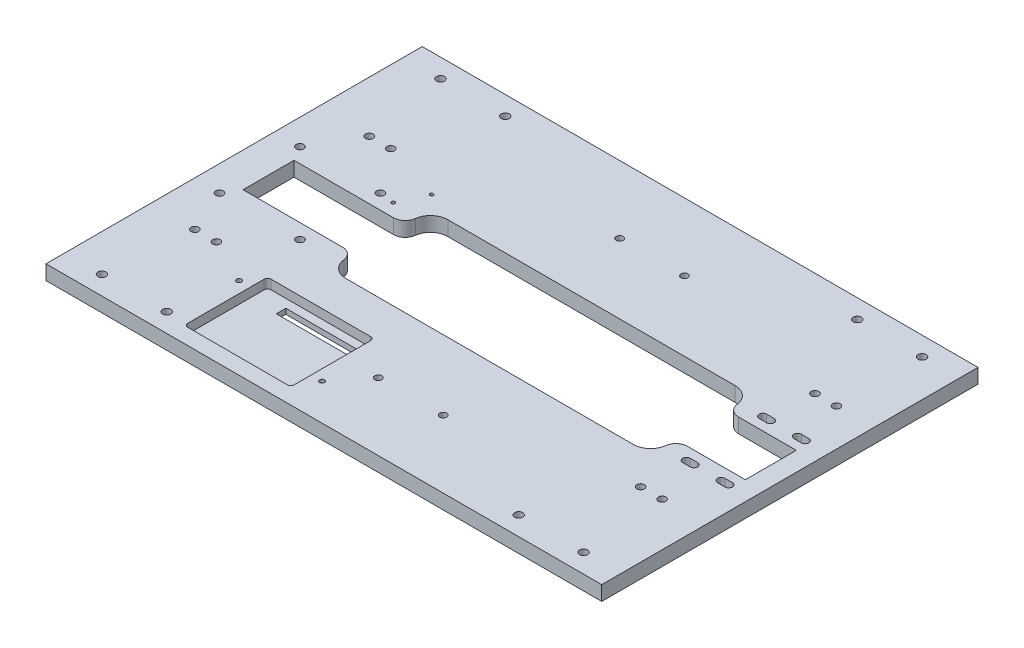
from build123d import *

# Parameters (mm, degrees)
SKETCH1_W           = 480
SKETCH1_H           = 325
BOSS_EXTRUDE1_DEPTH = 12.6
CUT_EXTRUDE1_REACH  = 292.112
SKETCH2_R           = 3
CUT_EXTRUDE2_REACH  = 292.112
FILLET1_R           = 10
CUT_EXTRUDE3_REACH  = 292.112
SKETCH4_R           = 3.3
FILLET2_R           = 10
CUT_EXTRUDE7_REACH  = 292.112
SKETCH7_R           = 2.25
SKETCH7_R_2         = 2.210159971
SKETCH7_R_3         = 2.104405515
SKETCH8_R           = 3.5
CUT_EXTRUDE8_DEPTH  = 6
CUT_EXTRUDE11_REACH = 292.112
SKETCH12_R          = 1.5
FILLET3_R           = 15
CUT_EXTRUDE12_DEPTH = 8
SKETCH14_W          = 63.584161833
SKETCH14_H          = 8.257095536
CUT_EXTRUDE13_DEPTH = 290.948702501
CUT_EXTRUDE14_REACH = 292.112
SKETCH15_R          = 3.25
CUT_EXTRUDE15_REACH = 292.112


with BuildPart() as part:
    # Sketch1 → Boss-Extrude1 (new body)
    with BuildSketch(Plane(origin=(0, 0, 0), x_dir=(1, 0, 0), z_dir=(0, 1, 0))):
        Rectangle(SKETCH1_W, SKETCH1_H)
    extrude(amount=BOSS_EXTRUDE1_DEPTH)

    # Sketch2 → Cut-Extrude1 (cut, up to next)
    with BuildSketch(Plane.XZ, mode=Mode.PRIVATE) as cut_extrude1_sk1:
        with Locations((44.748582867, -104.2)):
            Circle(SKETCH2_R)
    cut_extrude1_tool1 = extrude(cut_extrude1_sk1.sketch, amount=-CUT_EXTRUDE1_REACH, mode=Mode.PRIVATE) & part.part
    # Sketch2 → Cut-Extrude1 (cut, up to next)
    with BuildSketch(Plane.XZ, mode=Mode.PRIVATE) as cut_extrude1_sk2:
        with Locations((-11.251417133, -104.2)):
            Circle(SKETCH2_R)
    cut_extrude1_tool2 = extrude(cut_extrude1_sk2.sketch, amount=-CUT_EXTRUDE1_REACH, mode=Mode.PRIVATE) & part.part
    # Sketch2 → Cut-Extrude1 (cut, up to next)
    with BuildSketch(Plane.XZ, mode=Mode.PRIVATE) as cut_extrude1_sk3:
        with Locations((44.748582867, 104.2)):
            Circle(SKETCH2_R)
    cut_extrude1_tool3 = extrude(cut_extrude1_sk3.sketch, amount=-CUT_EXTRUDE1_REACH, mode=Mode.PRIVATE) & part.part
    # Sketch2 → Cut-Extrude1 (cut, up to next)
    with BuildSketch(Plane.XZ, mode=Mode.PRIVATE) as cut_extrude1_sk4:
        with Locations((-11.251417133, 104.2)):
            Circle(SKETCH2_R)
    cut_extrude1_tool4 = extrude(cut_extrude1_sk4.sketch, amount=-CUT_EXTRUDE1_REACH, mode=Mode.PRIVATE) & part.part
    add(cut_extrude1_tool1.solids().sort_by_distance((44.748583, 0, -104.2))[0], mode=Mode.SUBTRACT)
    add(cut_extrude1_tool2.solids().sort_by_distance((-11.251417, 0, -104.2))[0], mode=Mode.SUBTRACT)
    add(cut_extrude1_tool3.solids().sort_by_distance((44.748583, 0, 104.2))[0], mode=Mode.SUBTRACT)
    add(cut_extrude1_tool4.solids().sort_by_distance((-11.251417, 0, 104.2))[0], mode=Mode.SUBTRACT)

    # Sketch3 → Cut-Extrude2 (cut, up to next)
    with BuildSketch(Plane.XZ, mode=Mode.PRIVATE) as cut_extrude2_sk1:
        Polygon((163.584746975, 44), (-114.288669968, 44), (-114.288669968, 22), (-210.288669968, 22), (-210.288669968, -22), (-114.288669968, -22), (-114.288669968, -44), (163.584746975, -44), (163.584746975, -22), (223.584746975, -22), (223.584746975, 22), (163.584746975, 22), align=None)
    cut_extrude2_tool1 = extrude(cut_extrude2_sk1.sketch, amount=-CUT_EXTRUDE2_REACH, mode=Mode.PRIVATE) & part.part
    add(cut_extrude2_tool1.solids().sort_by_distance((13.675427, 0, 0))[0], mode=Mode.SUBTRACT)

    # Fillet1
    fillet1_edges = [part.edges().sort_by_distance(p)[0] for p in [
        (-114.288669968, 6.3, 22),
        (-114.288669968, 6.3, -22),
    ]]
    fillet(fillet1_edges, radius=FILLET1_R)

    # Sketch4 → Cut-Extrude3 (cut, up to next)
    with BuildSketch(Plane.XZ, mode=Mode.PRIVATE) as cut_extrude3_sk1:
        with Locations((-148.425714853, -34.75)):
            Circle(SKETCH4_R)
    cut_extrude3_tool1 = extrude(cut_extrude3_sk1.sketch, amount=-CUT_EXTRUDE3_REACH, mode=Mode.PRIVATE) & part.part
    # Sketch4 → Cut-Extrude3 (cut, up to next)
    with BuildSketch(Plane.XZ, mode=Mode.PRIVATE) as cut_extrude3_sk2:
        with Locations((-148.425714853, 34.75)):
            Circle(SKETCH4_R)
    cut_extrude3_tool2 = extrude(cut_extrude3_sk2.sketch, amount=-CUT_EXTRUDE3_REACH, mode=Mode.PRIVATE) & part.part
    # Sketch4 → Cut-Extrude3 (cut, up to next)
    with BuildSketch(Plane.XZ, mode=Mode.PRIVATE) as cut_extrude3_sk3:
        with Locations((-217.925714853, 34.75)):
            Circle(SKETCH4_R)
    cut_extrude3_tool3 = extrude(cut_extrude3_sk3.sketch, amount=-CUT_EXTRUDE3_REACH, mode=Mode.PRIVATE) & part.part
    # Sketch4 → Cut-Extrude3 (cut, up to next)
    with BuildSketch(Plane.XZ, mode=Mode.PRIVATE) as cut_extrude3_sk4:
        with Locations((-217.925714853, -34.75)):
            Circle(SKETCH4_R)
    cut_extrude3_tool4 = extrude(cut_extrude3_sk4.sketch, amount=-CUT_EXTRUDE3_REACH, mode=Mode.PRIVATE) & part.part
    add(cut_extrude3_tool1.solids().sort_by_distance((-148.425715, 0, -34.75))[0], mode=Mode.SUBTRACT)
    add(cut_extrude3_tool2.solids().sort_by_distance((-148.425715, 0, 34.75))[0], mode=Mode.SUBTRACT)
    add(cut_extrude3_tool3.solids().sort_by_distance((-217.925715, 0, 34.75))[0], mode=Mode.SUBTRACT)
    add(cut_extrude3_tool4.solids().sort_by_distance((-217.925715, 0, -34.75))[0], mode=Mode.SUBTRACT)

    # Fillet2
    fillet2_edges = [part.edges().sort_by_distance(p)[0] for p in [
        (163.584746975, 6.3, -22),
        (163.584746975, 6.3, 22),
    ]]
    fillet(fillet2_edges, radius=FILLET2_R)

    # Sketch7 → Cut-Extrude7 (cut, up to next)
    with BuildSketch(Plane(origin=(0, 12.6, 0), x_dir=(1, 0, 0), z_dir=(0, 1, 0)), mode=Mode.PRIVATE) as cut_extrude7_sk1:
        with Locations((208, -146.2)):
            Circle(SKETCH7_R)
    cut_extrude7_tool1 = extrude(cut_extrude7_sk1.sketch, amount=-CUT_EXTRUDE7_REACH, mode=Mode.PRIVATE) & part.part
    # Sketch7 → Cut-Extrude7 (cut, up to next)
    with BuildSketch(Plane(origin=(0, 12.6, 0), x_dir=(1, 0, 0), z_dir=(0, 1, 0)), mode=Mode.PRIVATE) as cut_extrude7_sk2:
        with Locations((152, -146.2)):
            Circle(SKETCH7_R)
    cut_extrude7_tool2 = extrude(cut_extrude7_sk2.sketch, amount=-CUT_EXTRUDE7_REACH, mode=Mode.PRIVATE) & part.part
    # Sketch7 → Cut-Extrude7 (cut, up to next)
    with BuildSketch(Plane(origin=(0, 12.6, 0), x_dir=(1, 0, 0), z_dir=(0, 1, 0)), mode=Mode.PRIVATE) as cut_extrude7_sk3:
        with Locations((-152, -146.2)):
            Circle(SKETCH7_R)
    cut_extrude7_tool3 = extrude(cut_extrude7_sk3.sketch, amount=-CUT_EXTRUDE7_REACH, mode=Mode.PRIVATE) & part.part
    # Sketch7 → Cut-Extrude7 (cut, up to next)
    with BuildSketch(Plane(origin=(0, 12.6, 0), x_dir=(1, 0, 0), z_dir=(0, 1, 0)), mode=Mode.PRIVATE) as cut_extrude7_sk4:
        with Locations((-208, -146.2)):
            Circle(SKETCH7_R)
    cut_extrude7_tool4 = extrude(cut_extrude7_sk4.sketch, amount=-CUT_EXTRUDE7_REACH, mode=Mode.PRIVATE) & part.part
    # Sketch7 → Cut-Extrude7 (cut, up to next)
    with BuildSketch(Plane(origin=(0, 12.6, 0), x_dir=(1, 0, 0), z_dir=(0, 1, 0)), mode=Mode.PRIVATE) as cut_extrude7_sk5:
        with Locations((-208, 146.2)):
            Circle(SKETCH7_R)
    cut_extrude7_tool5 = extrude(cut_extrude7_sk5.sketch, amount=-CUT_EXTRUDE7_REACH, mode=Mode.PRIVATE) & part.part
    # Sketch7 → Cut-Extrude7 (cut, up to next)
    with BuildSketch(Plane(origin=(0, 12.6, 0), x_dir=(1, 0, 0), z_dir=(0, 1, 0)), mode=Mode.PRIVATE) as cut_extrude7_sk6:
        with Locations((-152, 146.2)):
            Circle(SKETCH7_R)
    cut_extrude7_tool6 = extrude(cut_extrude7_sk6.sketch, amount=-CUT_EXTRUDE7_REACH, mode=Mode.PRIVATE) & part.part
    # Sketch7 → Cut-Extrude7 (cut, up to next)
    with BuildSketch(Plane(origin=(0, 12.6, 0), x_dir=(1, 0, 0), z_dir=(0, 1, 0)), mode=Mode.PRIVATE) as cut_extrude7_sk7:
        with Locations((208, 146.2)):
            Circle(SKETCH7_R)
    cut_extrude7_tool7 = extrude(cut_extrude7_sk7.sketch, amount=-CUT_EXTRUDE7_REACH, mode=Mode.PRIVATE) & part.part
    # Sketch7 → Cut-Extrude7 (cut, up to next)
    with BuildSketch(Plane(origin=(0, 12.6, 0), x_dir=(1, 0, 0), z_dir=(0, 1, 0)), mode=Mode.PRIVATE) as cut_extrude7_sk8:
        with Locations((152, 146.2)):
            Circle(SKETCH7_R)
    cut_extrude7_tool8 = extrude(cut_extrude7_sk8.sketch, amount=-CUT_EXTRUDE7_REACH, mode=Mode.PRIVATE) & part.part
    # Sketch7 → Cut-Extrude7 (cut, up to next)
    with BuildSketch(Plane(origin=(0, 12.6, 0), x_dir=(1, 0, 0), z_dir=(0, 1, 0)), mode=Mode.PRIVATE) as cut_extrude7_sk9:
        with Locations((-143.975181306, -91.729163581)):
            Circle(SKETCH7_R_2)
    cut_extrude7_tool9 = extrude(cut_extrude7_sk9.sketch, amount=-CUT_EXTRUDE7_REACH, mode=Mode.PRIVATE) & part.part
    # Sketch7 → Cut-Extrude7 (cut, up to next)
    with BuildSketch(Plane(origin=(0, 12.6, 0), x_dir=(1, 0, 0), z_dir=(0, 1, 0)), mode=Mode.PRIVATE) as cut_extrude7_sk10:
        with Locations((-32.975181306, -131.130382474)):
            Circle(SKETCH7_R_3)
    cut_extrude7_tool10 = extrude(cut_extrude7_sk10.sketch, amount=-CUT_EXTRUDE7_REACH, mode=Mode.PRIVATE) & part.part
    add(cut_extrude7_tool1.solids().sort_by_distance((208, 12.6, 146.2))[0], mode=Mode.SUBTRACT)
    add(cut_extrude7_tool2.solids().sort_by_distance((152, 12.6, 146.2))[0], mode=Mode.SUBTRACT)
    add(cut_extrude7_tool3.solids().sort_by_distance((-152, 12.6, 146.2))[0], mode=Mode.SUBTRACT)
    add(cut_extrude7_tool4.solids().sort_by_distance((-208, 12.6, 146.2))[0], mode=Mode.SUBTRACT)
    add(cut_extrude7_tool5.solids().sort_by_distance((-208, 12.6, -146.2))[0], mode=Mode.SUBTRACT)
    add(cut_extrude7_tool6.solids().sort_by_distance((-152, 12.6, -146.2))[0], mode=Mode.SUBTRACT)
    add(cut_extrude7_tool7.solids().sort_by_distance((208, 12.6, -146.2))[0], mode=Mode.SUBTRACT)
    add(cut_extrude7_tool8.solids().sort_by_distance((152, 12.6, -146.2))[0], mode=Mode.SUBTRACT)
    add(cut_extrude7_tool9.solids().sort_by_distance((-143.975181, 12.6, 91.729164))[0], mode=Mode.SUBTRACT)
    add(cut_extrude7_tool10.solids().sort_by_distance((-32.975181, 12.6, 131.130382))[0], mode=Mode.SUBTRACT)

    # Sketch8 → Cut-Extrude8 (cut)
    with BuildSketch(Plane(origin=(0, 12.6, 0), x_dir=(1, 0, 0), z_dir=(0, 1, 0))):
        with Locations((208, 146.2)):
            Circle(SKETCH8_R)
        with Locations((152, 146.2)):
            Circle(SKETCH8_R)
        with Locations((-152, 146.2)):
            Circle(SKETCH8_R)
        with Locations((-208, 146.2)):
            Circle(SKETCH8_R)
        with Locations((208, -146.2)):
            Circle(SKETCH8_R)
        with Locations((152, -146.2)):
            Circle(SKETCH8_R)
        with Locations((-208, -146.2)):
            Circle(SKETCH8_R)
        with Locations((-152, -146.2)):
            Circle(SKETCH8_R)
    extrude(amount=-CUT_EXTRUDE8_DEPTH, mode=Mode.SUBTRACT)

    # Sketch12 → Cut-Extrude11 (cut, up to next)
    with BuildSketch(Plane.XZ, mode=Mode.PRIVATE) as cut_extrude11_sk1:
        with Locations((-135.814791711, -33.263055365)):
            Circle(SKETCH12_R)
    cut_extrude11_tool1 = extrude(cut_extrude11_sk1.sketch, amount=-CUT_EXTRUDE11_REACH, mode=Mode.PRIVATE) & part.part
    # Sketch12 → Cut-Extrude11 (cut, up to next)
    with BuildSketch(Plane.XZ, mode=Mode.PRIVATE) as cut_extrude11_sk2:
        with Locations((-125.214791711, -55.863055365)):
            Circle(SKETCH12_R)
    cut_extrude11_tool2 = extrude(cut_extrude11_sk2.sketch, amount=-CUT_EXTRUDE11_REACH, mode=Mode.PRIVATE) & part.part
    add(cut_extrude11_tool1.solids().sort_by_distance((-135.814792, 0, -33.263055))[0], mode=Mode.SUBTRACT)
    add(cut_extrude11_tool2.solids().sort_by_distance((-125.214792, 0, -55.863055))[0], mode=Mode.SUBTRACT)

    # Fillet3
    fillet3_edges = [part.edges().sort_by_distance(p)[0] for p in [
        (163.584746975, 6.3, 44),
        (163.584746975, 6.3, -44),
        (-114.288669968, 6.3, 44),
        (-114.288669968, 6.3, -44),
    ]]
    fillet(fillet3_edges, radius=FILLET3_R)

    # Sketch9 → Cut-Extrude12 (cut)
    with BuildSketch(Plane(origin=(0, 12.6, 0), x_dir=(1, 0, 0), z_dir=(0, 1, 0))):
        with BuildLine():
            Line((-131.275181306, -76.793200215), (-45.275181306, -76.793200215))
            ThreePointArc((-45.275181306, -76.793200215), (-43.153860962, -77.671879872), (-42.275181306, -79.793200215))
            Line((-42.275181306, -79.793200215), (-42.275181306, -145.793200215))
            ThreePointArc((-42.275181306, -145.793200215), (-43.153860962, -147.914520559), (-45.275181306, -148.793200215))
            Line((-45.275181306, -148.793200215), (-131.275181306, -148.793200215))
            ThreePointArc((-131.275181306, -148.793200215), (-133.396501649, -147.914520559), (-134.275181306, -145.793200215))
            Line((-134.275181306, -145.793200215), (-134.275181306, -79.793200215))
            ThreePointArc((-134.275181306, -79.793200215), (-133.396501649, -77.671879872), (-131.275181306, -76.793200215))
        make_face()
    extrude(amount=-CUT_EXTRUDE12_DEPTH, mode=Mode.SUBTRACT)

    # Sketch14 → Cut-Extrude13 (cut, through all)
    with BuildSketch(Plane(origin=(0, 4.6, 0), x_dir=(1, 0, 0), z_dir=(0, 1, 0))):
        with Locations((-79.365102285, -88.291865052)):
            Rectangle(SKETCH14_W, SKETCH14_H)
    extrude(amount=-CUT_EXTRUDE13_DEPTH, mode=Mode.SUBTRACT)

    # Sketch15 → Cut-Extrude14 (cut, up to next)
    with BuildSketch(Plane(origin=(0, 12.6, 0), x_dir=(1, 0, 0), z_dir=(0, 1, 0)), mode=Mode.PRIVATE) as cut_extrude14_sk1:
        with Locations((-201.37519906, -72.5)):
            Circle(SKETCH15_R)
    cut_extrude14_tool1 = extrude(cut_extrude14_sk1.sketch, amount=-CUT_EXTRUDE14_REACH, mode=Mode.PRIVATE) & part.part
    # Sketch15 → Cut-Extrude14 (cut, up to next)
    with BuildSketch(Plane(origin=(0, 12.6, 0), x_dir=(1, 0, 0), z_dir=(0, 1, 0)), mode=Mode.PRIVATE) as cut_extrude14_sk2:
        with Locations((-182.864719491, -72.5)):
            Circle(SKETCH15_R)
    cut_extrude14_tool2 = extrude(cut_extrude14_sk2.sketch, amount=-CUT_EXTRUDE14_REACH, mode=Mode.PRIVATE) & part.part
    # Sketch15 → Cut-Extrude14 (cut, up to next)
    with BuildSketch(Plane(origin=(0, 12.6, 0), x_dir=(1, 0, 0), z_dir=(0, 1, 0)), mode=Mode.PRIVATE) as cut_extrude14_sk3:
        with Locations((-195.791828434, 72.5)):
            Circle(SKETCH15_R)
    cut_extrude14_tool3 = extrude(cut_extrude14_sk3.sketch, amount=-CUT_EXTRUDE14_REACH, mode=Mode.PRIVATE) & part.part
    # Sketch15 → Cut-Extrude14 (cut, up to next)
    with BuildSketch(Plane(origin=(0, 12.6, 0), x_dir=(1, 0, 0), z_dir=(0, 1, 0)), mode=Mode.PRIVATE) as cut_extrude14_sk4:
        with Locations((-177.281348865, 72.5)):
            Circle(SKETCH15_R)
    cut_extrude14_tool4 = extrude(cut_extrude14_sk4.sketch, amount=-CUT_EXTRUDE14_REACH, mode=Mode.PRIVATE) & part.part
    # Sketch15 → Cut-Extrude14 (cut, up to next)
    with BuildSketch(Plane(origin=(0, 12.6, 0), x_dir=(1, 0, 0), z_dir=(0, 1, 0)), mode=Mode.PRIVATE) as cut_extrude14_sk5:
        with Locations((189.208171566, 72.5)):
            Circle(SKETCH15_R)
    cut_extrude14_tool5 = extrude(cut_extrude14_sk5.sketch, amount=-CUT_EXTRUDE14_REACH, mode=Mode.PRIVATE) & part.part
    # Sketch15 → Cut-Extrude14 (cut, up to next)
    with BuildSketch(Plane(origin=(0, 12.6, 0), x_dir=(1, 0, 0), z_dir=(0, 1, 0)), mode=Mode.PRIVATE) as cut_extrude14_sk6:
        with Locations((207.718651135, 72.5)):
            Circle(SKETCH15_R)
    cut_extrude14_tool6 = extrude(cut_extrude14_sk6.sketch, amount=-CUT_EXTRUDE14_REACH, mode=Mode.PRIVATE) & part.part
    # Sketch15 → Cut-Extrude14 (cut, up to next)
    with BuildSketch(Plane(origin=(0, 12.6, 0), x_dir=(1, 0, 0), z_dir=(0, 1, 0)), mode=Mode.PRIVATE) as cut_extrude14_sk7:
        with Locations((183.62480094, -72.5)):
            Circle(SKETCH15_R)
    cut_extrude14_tool7 = extrude(cut_extrude14_sk7.sketch, amount=-CUT_EXTRUDE14_REACH, mode=Mode.PRIVATE) & part.part
    # Sketch15 → Cut-Extrude14 (cut, up to next)
    with BuildSketch(Plane(origin=(0, 12.6, 0), x_dir=(1, 0, 0), z_dir=(0, 1, 0)), mode=Mode.PRIVATE) as cut_extrude14_sk8:
        with Locations((202.135280509, -72.5)):
            Circle(SKETCH15_R)
    cut_extrude14_tool8 = extrude(cut_extrude14_sk8.sketch, amount=-CUT_EXTRUDE14_REACH, mode=Mode.PRIVATE) & part.part
    add(cut_extrude14_tool1.solids().sort_by_distance((-201.375199, 12.6, 72.5))[0], mode=Mode.SUBTRACT)
    add(cut_extrude14_tool2.solids().sort_by_distance((-182.864719, 12.6, 72.5))[0], mode=Mode.SUBTRACT)
    add(cut_extrude14_tool3.solids().sort_by_distance((-195.791828, 12.6, -72.5))[0], mode=Mode.SUBTRACT)
    add(cut_extrude14_tool4.solids().sort_by_distance((-177.281349, 12.6, -72.5))[0], mode=Mode.SUBTRACT)
    add(cut_extrude14_tool5.solids().sort_by_distance((189.208172, 12.6, -72.5))[0], mode=Mode.SUBTRACT)
    add(cut_extrude14_tool6.solids().sort_by_distance((207.718651, 12.6, -72.5))[0], mode=Mode.SUBTRACT)
    add(cut_extrude14_tool7.solids().sort_by_distance((183.624801, 12.6, 72.5))[0], mode=Mode.SUBTRACT)
    add(cut_extrude14_tool8.solids().sort_by_distance((202.135281, 12.6, 72.5))[0], mode=Mode.SUBTRACT)

    # Sketch16 → Cut-Extrude15 (cut, up to next)
    with BuildSketch(Plane(origin=(0, 12.6, 0), x_dir=(1, 0, 0), z_dir=(0, 1, 0)), mode=Mode.PRIVATE) as cut_extrude15_sk1:
        with BuildLine():
            Line((183.672880587, -36.25), (190.172880587, -36.25))
            ThreePointArc((190.172880587, -36.25), (193.422880587, -33), (190.172880587, -29.75))
            Line((190.172880587, -29.75), (183.672880587, -29.75))
            ThreePointArc((183.672880587, -29.75), (180.422880587, -33), (183.672880587, -36.25))
        make_face()
    cut_extrude15_tool1 = extrude(cut_extrude15_sk1.sketch, amount=-CUT_EXTRUDE15_REACH, mode=Mode.PRIVATE) & part.part
    # Sketch16 → Cut-Extrude15 (cut, up to next)
    with BuildSketch(Plane(origin=(0, 12.6, 0), x_dir=(1, 0, 0), z_dir=(0, 1, 0)), mode=Mode.PRIVATE) as cut_extrude15_sk2:
        with BuildLine():
            Line((213.672880587, -36.25), (220.172880587, -36.25))
            ThreePointArc((220.172880587, -36.25), (223.422880587, -33), (220.172880587, -29.75))
            Line((220.172880587, -29.75), (213.672880587, -29.75))
            ThreePointArc((213.672880587, -29.75), (210.422880587, -33), (213.672880587, -36.25))
        make_face()
    cut_extrude15_tool2 = extrude(cut_extrude15_sk2.sketch, amount=-CUT_EXTRUDE15_REACH, mode=Mode.PRIVATE) & part.part
    # Sketch16 → Cut-Extrude15 (cut, up to next)
    with BuildSketch(Plane(origin=(0, 12.6, 0), x_dir=(1, 0, 0), z_dir=(0, 1, 0)), mode=Mode.PRIVATE) as cut_extrude15_sk3:
        with BuildLine():
            Line((183.672880587, 29.75), (190.172880587, 29.75))
            ThreePointArc((190.172880587, 29.75), (193.422880587, 33), (190.172880587, 36.25))
            Line((190.172880587, 36.25), (183.672880587, 36.25))
            ThreePointArc((183.672880587, 36.25), (180.422880587, 33), (183.672880587, 29.75))
        make_face()
    cut_extrude15_tool3 = extrude(cut_extrude15_sk3.sketch, amount=-CUT_EXTRUDE15_REACH, mode=Mode.PRIVATE) & part.part
    # Sketch16 → Cut-Extrude15 (cut, up to next)
    with BuildSketch(Plane(origin=(0, 12.6, 0), x_dir=(1, 0, 0), z_dir=(0, 1, 0)), mode=Mode.PRIVATE) as cut_extrude15_sk4:
        with BuildLine():
            Line((213.672880587, 29.75), (220.172880587, 29.75))
            ThreePointArc((220.172880587, 29.75), (223.422880587, 33), (220.172880587, 36.25))
            Line((220.172880587, 36.25), (213.672880587, 36.25))
            ThreePointArc((213.672880587, 36.25), (210.422880587, 33), (213.672880587, 29.75))
        make_face()
    cut_extrude15_tool4 = extrude(cut_extrude15_sk4.sketch, amount=-CUT_EXTRUDE15_REACH, mode=Mode.PRIVATE) & part.part
    add(cut_extrude15_tool1.solids().sort_by_distance((186.922881, 12.6, 33))[0], mode=Mode.SUBTRACT)
    add(cut_extrude15_tool2.solids().sort_by_distance((216.922881, 12.6, 33))[0], mode=Mode.SUBTRACT)
    add(cut_extrude15_tool3.solids().sort_by_distance((186.922881, 12.6, -33))[0], mode=Mode.SUBTRACT)
    add(cut_extrude15_tool4.solids().sort_by_distance((216.922881, 12.6, -33))[0], mode=Mode.SUBTRACT)


solid = part.part
